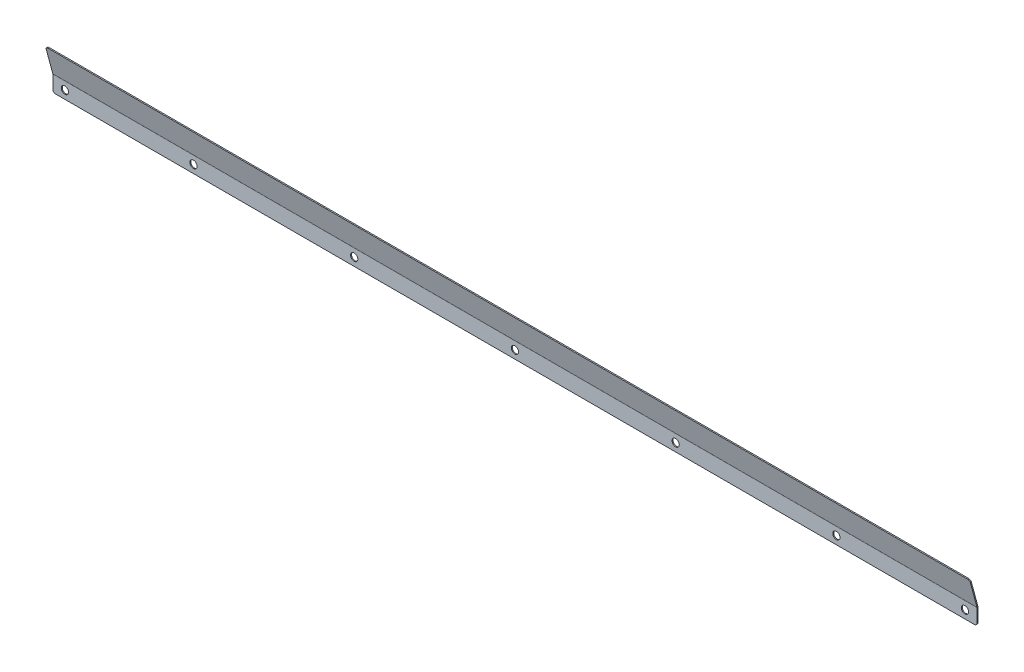
from build123d import *

# Parameters (mm, degrees)
SKETCH1_W                    = 1150
SKETCH1_H                    = 20
BASE_FLANGE1_DEPTH           = 1.21412
EDGE_FLANGE1_STRIP_CUT_DEPTH = 1150
EDGE_FLANGE1_DEPTH           = 1150
M8_CLEARANCE_HOLE1_D         = 9
CHAMFER1_SIZE                = 2


# Sheet-metal steps are written as plain solids
with BuildPart() as part:
    # Sketch1 → Base-Flange1 (new body)
    with BuildSketch(Plane.XY):
        Rectangle(SKETCH1_W, SKETCH1_H)
    extrude(amount=-BASE_FLANGE1_DEPTH)

    # Edge-Flange1 strip (across the edge) → Edge-Flange1 strip cut (cut)
    with BuildSketch(Plane(origin=(575, 10, 0), x_dir=(0, -0.2588190451025146, 0.96592582628907), z_dir=(-1, 0, 0))):
        Polygon((-3.043825554, 6.668712161), (-1.129475664, -0.475738894), (0.043274201, -0.161501515), (-1.87107569, 6.98294954), align=None)
    extrude(amount=EDGE_FLANGE1_STRIP_CUT_DEPTH, mode=Mode.SUBTRACT)

    # Edge-Flange1 section (across the edge) → Edge-Flange1 (add)
    with BuildSketch(Plane(origin=(575, 10, 0), x_dir=(0, -0.2588190451025146, 0.96592582628907), z_dir=(-1, 0, 0))):
        with BuildLine():
            Line((-1.21412, 0.167198672), (-1.21412, 34.84015807))
            Line((-1.21412, 34.84015807), (0, 34.84015807))
            Line((0, 34.84015807), (0, 0.167198672))
            ThreePointArc((0, 0.167198672), (0.010865026, 0.001430408), (0.043274201, -0.161501515))
            Line((0.043274201, -0.161501515), (-1.129475664, -0.475738894))
            ThreePointArc((-1.129475664, -0.475738894), (-1.192868009, -0.157044053), (-1.21412, 0.167198672))
        make_face()
    extrude(amount=EDGE_FLANGE1_DEPTH)

    # M8 Clearance Hole1 (through all)
    with Locations(Plane.XY):
        with Locations((560, 0), (400, 0), (200, 0), (0, 0), (-200, 0), (-400, 0), (-560, 0)):
            Hole(M8_CLEARANCE_HOLE1_D / 2)

    # Chamfer1
    chamfer1_edges = [part.edges().sort_by_distance(p)[0] for p in [
        (575, 43.810127161, 8.430921511),
        (-575, 43.810127161, 8.430921511),
        (575, -10, -0.60706),
        (-575, -10, -0.60706),
    ]]
    chamfer(chamfer1_edges, length=CHAMFER1_SIZE)


solid = part.part
